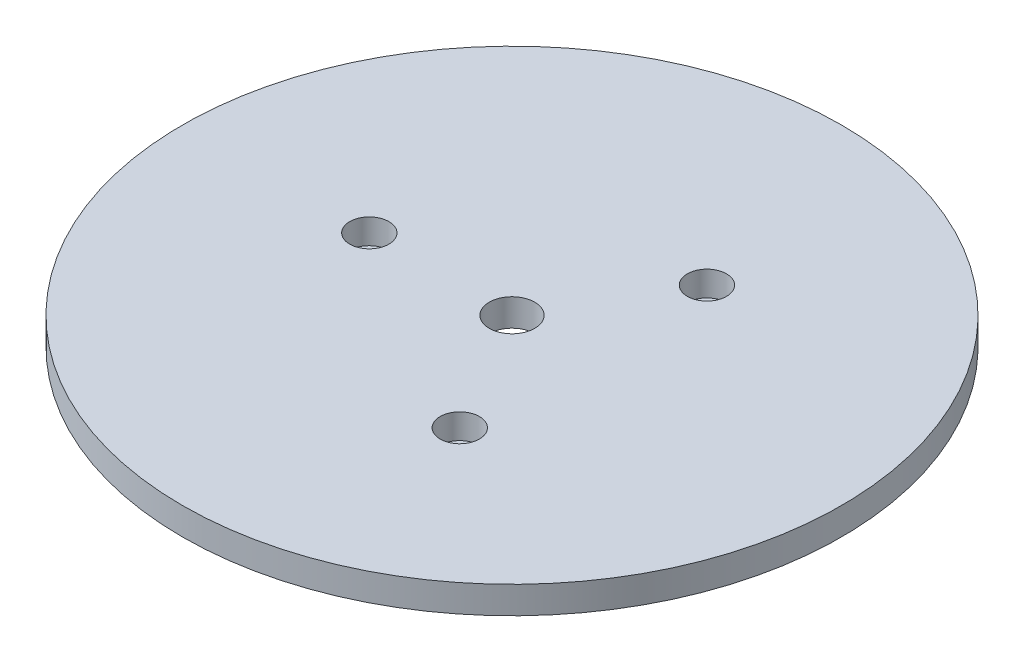
from build123d import *

# Parameters (mm, degrees)
SKETCH1_R           = 72.5
BOSS_EXTRUDE1_DEPTH = 6
SKETCH2_R           = 5
CUT_EXTRUDE1_DEPTH  = 103.705890776
SKETCH3_R           = 4.308344106
CUT_EXTRUDE2_DEPTH  = 5.491094722
CIRPATTERN1_COUNT   = 3


with BuildPart() as part:
    # Sketch1 → Boss-Extrude1 (new body)
    with BuildSketch(Plane(origin=(0, 0, 0), x_dir=(1, 0, 0), z_dir=(0, 1, 0))):
        Circle(SKETCH1_R)
    extrude(amount=BOSS_EXTRUDE1_DEPTH)

    # Sketch2 → Cut-Extrude1 (cut, through all)
    with BuildSketch(Plane(origin=(0, 0, 0), x_dir=(1, 0, 0), z_dir=(0, 1, 0))):
        Circle(SKETCH2_R)
    extrude(amount=CUT_EXTRUDE1_DEPTH, mode=Mode.SUBTRACT)

    # Sketch3 → Cut-Extrude2 (cut)
    with BuildSketch(Plane(origin=(0, 6, 0), x_dir=(1, 0, 0), z_dir=(0, 1, 0))):
        with Locations((-31.391564651, 0)):
            Circle(SKETCH3_R)
    cut_extrude2 = extrude(amount=-CUT_EXTRUDE2_DEPTH, mode=Mode.SUBTRACT)

    # CirPattern1: Cut-Extrude2 ×3 about axis
    cirpattern1_axis = Axis((0, 0, 0), (0, 1, 0))
    for i in range(1, CIRPATTERN1_COUNT):
        add(cut_extrude2.rotate(cirpattern1_axis, i * 360 / CIRPATTERN1_COUNT), mode=Mode.SUBTRACT)


solid = part.part
